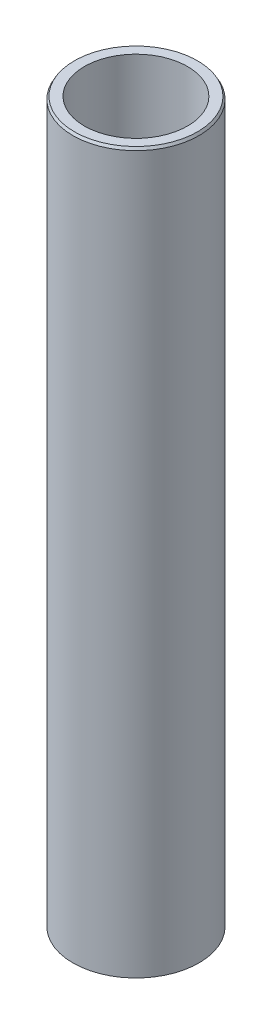
from build123d import *
from OCP.BRepFilletAPI import BRepFilletAPI_MakeChamfer

# Parameters (mm, degrees)
SKETCH1_R           = 52.5
BOSS_EXTRUDE1_DEPTH = 600
SKETCH2_R           = 42.966673097
CUT_EXTRUDE1_DEPTH  = 605.576297914
CHAMFER1_SIZE       = 2.142810958
CHAMFER1_SIZE2      = 1.237152484


with BuildPart() as part:
    # Sketch1 → Boss-Extrude1 (new body)
    with BuildSketch(Plane(origin=(0, 0, 0), x_dir=(1, 0, 0), z_dir=(0, 1, 0))):
        Circle(SKETCH1_R)
    extrude(amount=BOSS_EXTRUDE1_DEPTH)

    # Sketch2 → Cut-Extrude1 (cut, through all)
    with BuildSketch(Plane(origin=(0, 0, 0), x_dir=(1, 0, 0), z_dir=(0, 1, 0))):
        Circle(SKETCH2_R)
    extrude(amount=CUT_EXTRUDE1_DEPTH, mode=Mode.SUBTRACT)

    # Chamfer1: one chamfer whose edges measure the first distance from different faces: ONE call of the kernel's chamfer builder (chamfer() names one face for all edges)
    chamfer1_edges_1 = [part.edges().sort_by_distance(p)[0] for p in [
        (-52.5, 600, 0),
    ]]
    chamfer1_side_1 = [part.faces().sort_by_distance(p)[0] for p in [
        (-52.5, 300, 0),
    ]]
    chamfer1_edges_2 = [part.edges().sort_by_distance(p)[0] for p in [
        (-52.5, 0, 0),
    ]]
    chamfer1_side_2 = [part.faces().sort_by_distance(p)[0] for p in [
        (-51.01507576, 0, 0),
    ]]
    chamfer1 = BRepFilletAPI_MakeChamfer(part.part.solid().wrapped)
    for e in chamfer1_edges_1:
        chamfer1.Add(CHAMFER1_SIZE, CHAMFER1_SIZE2, e.wrapped, chamfer1_side_1[0].wrapped)  # the first distance lies on this face
    for e in chamfer1_edges_2:
        chamfer1.Add(CHAMFER1_SIZE, CHAMFER1_SIZE2, e.wrapped, chamfer1_side_2[0].wrapped)  # the first distance lies on this face
    add(Compound.cast(chamfer1.Shape()), mode=Mode.REPLACE)


solid = part.part
